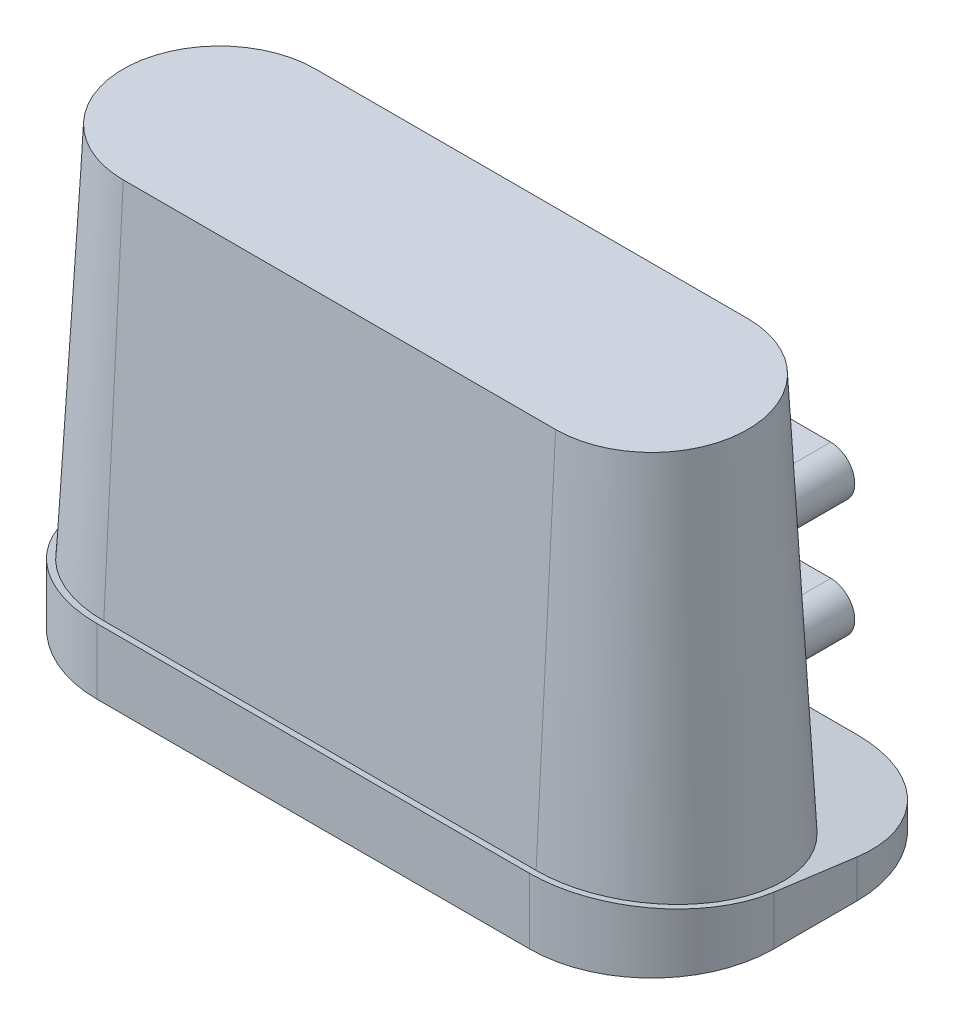
from build123d import *

# Parameters (mm, degrees)
SKETCH_2_W          = 155
SKETCH_2_H          = 75
EXTRUDE_1_DEPTH     = 15
CUT_EXTRUDE_1_DEPTH = 161.175684796
FILLET_1_R          = 28
EXTRUDE_2_DEPTH     = 100
CHAMFER_1_SIZE      = 95.405683439
CHAMFER_1_SIZE_2    = 5
EXTRUDE_3_DEPTH     = 30
CUT_EXTRUDE_4_REACH = 145.596


with BuildPart() as part:
    # 스케치2 → 보스-돌출1 (new body)
    with BuildSketch(Plane(origin=(0, 0, 0), x_dir=(1, 0, 0), z_dir=(0, 1, 0))):
        Rectangle(SKETCH_2_W, SKETCH_2_H)
    extrude(amount=EXTRUDE_1_DEPTH)

    # 스케치3 → 컷-돌출1 (cut, through all)
    with BuildSketch(Plane(origin=(77.5, 0, 0), x_dir=(0, 0, -1), z_dir=(1, 0, 0))):
        Polygon((37.5, 5), (-37.5, 15), (37.5, 15), align=None)
    extrude(amount=-CUT_EXTRUDE_1_DEPTH, mode=Mode.SUBTRACT)

    # 필렛1
    fillet_1_edges = [part.edges().sort_by_distance(p)[0] for p in [
        (-77.5, 2.5, -37.5),
        (77.5, 2.5, -37.5),
        (77.5, 7.5, 37.5),
        (-77.5, 7.5, 37.5),
    ]]
    fillet(fillet_1_edges, radius=FILLET_1_R)

    # 스케치4 → 보스-돌출2 (add)
    with BuildSketch(Plane.XZ):
        with BuildLine():
            Line((-49.5, 36.5), (49.5, 36.5))
            ThreePointArc((49.5, 36.5), (76.5, 9.5), (49.5, -17.5))
            Line((49.5, -17.5), (-49.5, -17.5))
            ThreePointArc((-49.5, -17.5), (-76.5, 9.5), (-49.5, 36.5))
        make_face()
    extrude(amount=-EXTRUDE_2_DEPTH)

    # 모따기1
    # the kernel refuses this chamfer: 95.405683439, 5 mm, written as the material it takes off along each edge
    with BuildSketch(Plane(origin=(-49.5, 100, 36.5), x_dir=(0, -0.9999979738662977, 0.0020130234223821315), z_dir=(1, 0, 0))) as chamfer_1_piece_1_section:
        Polygon((CHAMFER_1_SIZE * 0.999997973863, CHAMFER_1_SIZE * 0.00201302342237), (-CHAMFER_1_SIZE_2 * 0.00201302342238, CHAMFER_1_SIZE_2 * 0.999997973866), (0, 0), align=None)
    chamfer_1_piece_1 = extrude(amount=99, mode=Mode.PRIVATE)
    chamfer_1_piece_1 = split(chamfer_1_piece_1, bisect_by=Plane(origin=(0, 15.586966884, 41.90225163), z_dir=(0, 0.9912279006826347, -0.13216372009101798)), keep=Keep.TOP, mode=Mode.PRIVATE)
    add(chamfer_1_piece_1, mode=Mode.SUBTRACT)
    with BuildSketch(Plane(origin=(-49.5, 100, 9.5), x_dir=(0, 0, -1), z_dir=(1, 0, 0))) as chamfer_1_piece_2_section:
        Polygon((27, -CHAMFER_1_SIZE), (27 - CHAMFER_1_SIZE_2, 0), (27, 0), align=None)
    chamfer_1_piece_2 = revolve(axis=Axis((-49.5, 100, 9.5), (0, 1, 0)), revolution_arc=180, mode=Mode.PRIVATE)
    chamfer_1_piece_2 = split(chamfer_1_piece_2, bisect_by=Plane(origin=(-74.18479248, 12.010621427, 15.0796607), z_dir=(0, 0.9912279006826347, -0.13216372009101798)), keep=Keep.TOP, mode=Mode.PRIVATE)
    add(chamfer_1_piece_2, mode=Mode.SUBTRACT)
    with BuildSketch(Plane(origin=(49.5, 100, 9.5), x_dir=(0, 0, 1), z_dir=(-1, 0, 0))) as chamfer_1_piece_3_section:
        Polygon((27, -CHAMFER_1_SIZE), (27 - CHAMFER_1_SIZE_2, 0), (27, 0), align=None)
    chamfer_1_piece_3 = revolve(axis=Axis((49.5, 100, 9.5), (0, 1, 0)), revolution_arc=180, mode=Mode.PRIVATE)
    chamfer_1_piece_3 = split(chamfer_1_piece_3, bisect_by=Plane(origin=(74.18479248, 12.010621427, 15.0796607), z_dir=(0, 0.9912279006826347, -0.13216372009101798)), keep=Keep.TOP, mode=Mode.PRIVATE)
    add(chamfer_1_piece_3, mode=Mode.SUBTRACT)
    with BuildSketch(Plane(origin=(49.5, 100, -17.5), x_dir=(0, -0.9999979738662977, -0.0020130234223820955), z_dir=(-1, 0, 0))) as chamfer_1_piece_4_section:
        Polygon((CHAMFER_1_SIZE * 0.999997973863, CHAMFER_1_SIZE * 0.00201302342237), (-CHAMFER_1_SIZE_2 * 0.00201302342238, CHAMFER_1_SIZE_2 * 0.999997973866), (0, 0), align=None)
    chamfer_1_piece_4 = extrude(amount=99, mode=Mode.PRIVATE)
    chamfer_1_piece_4 = split(chamfer_1_piece_4, bisect_by=Plane(origin=(0, 8.9149356, -8.137983001), z_dir=(0, 0.9912279006826347, -0.13216372009101798)), keep=Keep.TOP, mode=Mode.PRIVATE)
    add(chamfer_1_piece_4, mode=Mode.SUBTRACT)

    # 스케치6 → 보스-돌출3 (add)
    with BuildSketch(Plane.XY):
        with BuildLine():
            Line((-51, 67.5), (51, 67.5))
            ThreePointArc((51, 67.5), (56.5, 62), (51, 56.5))
            Line((51, 56.5), (-51, 56.5))
            ThreePointArc((-51, 56.5), (-56.5, 62), (-51, 67.5))
        make_face()
        with BuildLine():
            Line((-51, 40.5), (51, 40.5))
            ThreePointArc((51, 40.5), (56.5, 35), (51, 29.5))
            Line((51, 29.5), (-51, 29.5))
            ThreePointArc((-51, 29.5), (-56.5, 35), (-51, 40.5))
        make_face()
    extrude(amount=-EXTRUDE_3_DEPTH)

    # 컷-돌출4: from a plane face, 145.596 long prism both ways, kept between that surface and its translate by the depth
    cut_extrude_4_start = Plane(origin=(-49.5, 4.594316561, -17.5), z_dir=(0, 0.05233595624294105, -0.998629534754574)) * Box(584.384, 584.384, 292.192, align=(Align.CENTER, Align.CENTER, Align.MIN), mode=Mode.PRIVATE)
    cut_extrude_4_end = Plane(origin=(-49.5, 4.594316561, -17.3), z_dir=(0, 0.05233595624294105, -0.998629534754574)) * Box(584.384, 584.384, 292.192, align=(Align.CENTER, Align.CENTER, Align.MIN), mode=Mode.PRIVATE)
    # 스케치8 → 컷-돌출4 (cut, from a surface)
    with BuildSketch(Plane(origin=(0, 0, -30), x_dir=(-1, 0, 0), z_dir=(0, 0, -1)), mode=Mode.PRIVATE) as cut_extrude_4_sk1:
        with BuildLine():
            Line((-1.75, 90), (1.75, 90))
            ThreePointArc((1.75, 90), (2.75, 89), (1.75, 88))
            Line((1.75, 88), (-1.75, 88))
            ThreePointArc((-1.75, 88), (-2.75, 89), (-1.75, 90))
        make_face()
    cut_extrude_4_tool1 = extrude(cut_extrude_4_sk1.sketch, amount=CUT_EXTRUDE_4_REACH, both=True, mode=Mode.PRIVATE)
    add(((cut_extrude_4_tool1 - cut_extrude_4_start) & cut_extrude_4_end).solids().sort_by_distance((0, 89, -12.976486))[0], mode=Mode.SUBTRACT)


solid = part.part
